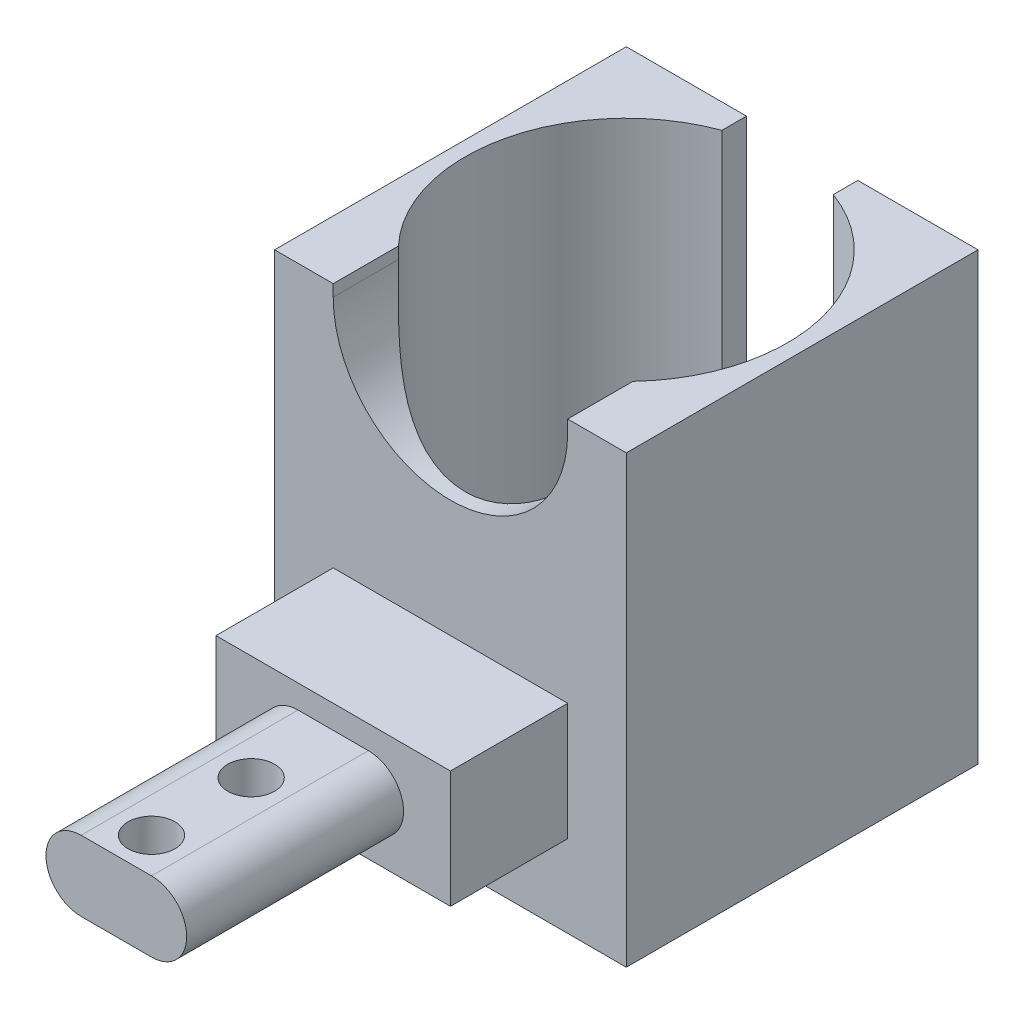
from build123d import *

# Parameters (mm, degrees)
SKETCH1_W           = 30
SKETCH1_H           = 36
BOSS_EXTRUDE1_DEPTH = 30
SKETCH2_W           = 20
SKETCH2_H           = 10
BOSS_EXTRUDE2_DEPTH = 10
BOSS_EXTRUDE3_DEPTH = 18.5
CUT_EXTRUDE2_REACH  = 72.308
SKETCH4_R           = 13.75
CUT_EXTRUDE5_REACH  = 65.018
CUT_EXTRUDE6_REACH  = 40.066
CUT_EXTRUDE7_REACH  = 72.308
SKETCH9_R           = 2
SKETCH10_W          = 30
SKETCH10_H          = 30
BOSS_EXTRUDE4_DEPTH = 2
CUT_EXTRUDE8_REACH  = 72.308
SKETCH11_R          = 13.25


with BuildPart() as part:
    # Sketch1 → Boss-Extrude1 (new body)
    with BuildSketch(Plane.XY):
        Rectangle(SKETCH1_W, SKETCH1_H)
    extrude(amount=BOSS_EXTRUDE1_DEPTH)

    # Sketch2 → Boss-Extrude2 (add)
    with BuildSketch(Plane.XY.offset(30)):
        with Locations((0, -8)):
            Rectangle(SKETCH2_W, SKETCH2_H)
    extrude(amount=BOSS_EXTRUDE2_DEPTH)

    # Sketch3 → Boss-Extrude3 (add)
    with BuildSketch(Plane.XY.offset(40)):
        with BuildLine():
            Line((-3, -5), (3, -5))
            ThreePointArc((3, -5), (6, -8), (3, -11))
            Line((3, -11), (-3, -11))
            ThreePointArc((-3, -11), (-6, -8), (-3, -5))
        make_face()
    extrude(amount=BOSS_EXTRUDE3_DEPTH)

    # Sketch4 → Cut-Extrude2 (cut, up to next)
    with BuildSketch(Plane(origin=(0, 18, 0), x_dir=(1, 0, 0), z_dir=(0, 1, 0)), mode=Mode.PRIVATE) as cut_extrude2_sk1:
        with Locations((0, -15)):
            Circle(SKETCH4_R)
    cut_extrude2_tool1 = extrude(cut_extrude2_sk1.sketch, amount=-CUT_EXTRUDE2_REACH, mode=Mode.PRIVATE) & part.part
    add(cut_extrude2_tool1.solids().sort_by_distance((0, 18, 15))[0], mode=Mode.SUBTRACT)

    # Sketch6 → Cut-Extrude5 (cut, up to next)
    with BuildSketch(Plane(origin=(0, 0, 0), x_dir=(-1, 0, 0), z_dir=(0, 0, -1)), mode=Mode.PRIVATE) as cut_extrude5_sk1:
        with BuildLine():
            Line((-4.75, -2.25), (-4.75, 18))
            ThreePointArc((-4.75, 18), (0, 22.75), (4.75, 18))
            Line((4.75, 18), (4.75, -2.25))
            ThreePointArc((4.75, -2.25), (0, -7), (-4.75, -2.25))
        make_face()
    cut_extrude5_tool1 = extrude(cut_extrude5_sk1.sketch, amount=-CUT_EXTRUDE5_REACH, mode=Mode.PRIVATE) & part.part
    add(cut_extrude5_tool1.solids().sort_by_distance((0, 7.875, 0))[0], mode=Mode.SUBTRACT)

    # Sketch8 → Cut-Extrude6 (cut, up to next)
    with BuildSketch(Plane.XY.offset(30), mode=Mode.PRIVATE) as cut_extrude6_sk1:
        with BuildLine():
            Line((-10, 17), (-10, 18))
            ThreePointArc((-10, 18), (0, 28), (10, 18))
            Line((10, 18), (10, 17))
            ThreePointArc((10, 17), (0, 7), (-10, 17))
        make_face()
    cut_extrude6_tool1 = extrude(cut_extrude6_sk1.sketch, amount=-CUT_EXTRUDE6_REACH, mode=Mode.PRIVATE) & part.part
    add(cut_extrude6_tool1.solids().sort_by_distance((0, 17.5, 30))[0], mode=Mode.SUBTRACT)

    # Sketch9 → Cut-Extrude7 (cut, up to next)
    with BuildSketch(Plane.XZ.offset(18), mode=Mode.PRIVATE) as cut_extrude7_sk1:
        with Locations((0, 55.5)):
            Circle(SKETCH9_R)
    cut_extrude7_tool1 = extrude(cut_extrude7_sk1.sketch, amount=-CUT_EXTRUDE7_REACH, mode=Mode.PRIVATE) & part.part
    # Sketch9 → Cut-Extrude7 (cut, up to next)
    with BuildSketch(Plane.XZ.offset(18), mode=Mode.PRIVATE) as cut_extrude7_sk2:
        with Locations((0, 47)):
            Circle(SKETCH9_R)
    cut_extrude7_tool2 = extrude(cut_extrude7_sk2.sketch, amount=-CUT_EXTRUDE7_REACH, mode=Mode.PRIVATE) & part.part
    add(cut_extrude7_tool1.solids().sort_by_distance((0, -18, 55.5))[0], mode=Mode.SUBTRACT)
    add(cut_extrude7_tool2.solids().sort_by_distance((0, -18, 47))[0], mode=Mode.SUBTRACT)

    # Sketch10 → Boss-Extrude4 (add)
    with BuildSketch(Plane(origin=(0, -18, 0), x_dir=(-1, 0, 0), z_dir=(0, -1, 0))):
        with Locations((0, -15)):
            Rectangle(SKETCH10_W, SKETCH10_H)
    extrude(amount=BOSS_EXTRUDE4_DEPTH)

    # Sketch11 → Cut-Extrude8 (cut, up to next)
    with BuildSketch(Plane(origin=(0, -18, 0), x_dir=(1, 0, 0), z_dir=(0, 1, 0)), mode=Mode.PRIVATE) as cut_extrude8_sk1:
        with Locations((0, -15)):
            Circle(SKETCH11_R)
    cut_extrude8_tool1 = extrude(cut_extrude8_sk1.sketch, amount=-CUT_EXTRUDE8_REACH, mode=Mode.PRIVATE) & part.part
    add(cut_extrude8_tool1.solids().sort_by_distance((0, -18, 15))[0], mode=Mode.SUBTRACT)


solid = part.part
